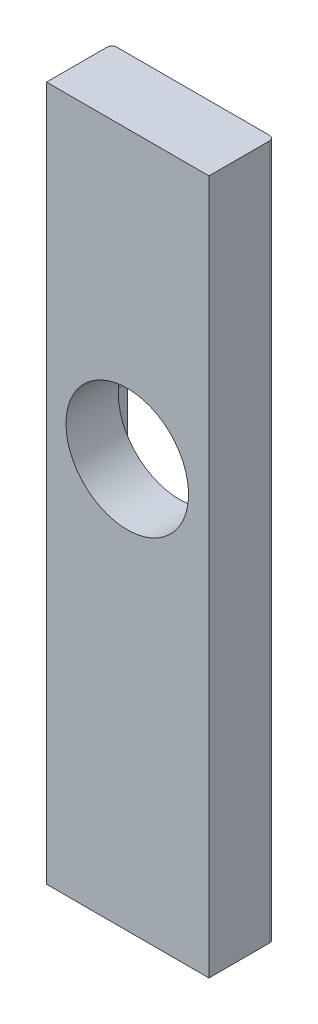
from build123d import *

# Parameters (mm, degrees)
SKETCH1_W          = 12.6238
SKETCH1_H          = 53.975
BLANK_DEPTH        = 5.08
SLOT_DEPTH         = 1.016
SKETCH3_R          = 4.7625
THROUGH_HOLE_DEPTH = 55.498983669
FILLET1_R          = 0.381


with BuildPart() as part:
    # Sketch1 → blank (new body)
    with BuildSketch(Plane.XY):
        with Locations((0.0381, 26.9875)):
            Rectangle(SKETCH1_W, SKETCH1_H)
    extrude(amount=BLANK_DEPTH)

    # Sketch2 → slot (cut)
    with BuildSketch(Plane.XY):
        with BuildLine():
            Line((-5.08, -31.75), (-5.08, 31.75))
            ThreePointArc((-5.08, 31.75), (0, 36.83), (5.08, 31.75))
            Line((5.08, 31.75), (5.08, -31.75))
            ThreePointArc((5.08, -31.75), (0, -36.83), (-5.08, -31.75))
        make_face()
    extrude(amount=SLOT_DEPTH, mode=Mode.SUBTRACT)

    # Sketch3 → through_hole (cut, through all)
    with BuildSketch(Plane(origin=(0, 0, 1.016), x_dir=(-1, 0, 0), z_dir=(0, 0, -1))):
        with Locations((0, 31.75)):
            Circle(SKETCH3_R)
    extrude(amount=-THROUGH_HOLE_DEPTH, mode=Mode.SUBTRACT)

    # Fillet1
    fillet1_edges = [part.edges().sort_by_distance(p)[0] for p in [
        (-6.2738, 26.9875, 0),
        (6.35, 26.9875, 0),
    ]]
    fillet(fillet1_edges, radius=FILLET1_R)


solid = part.part
